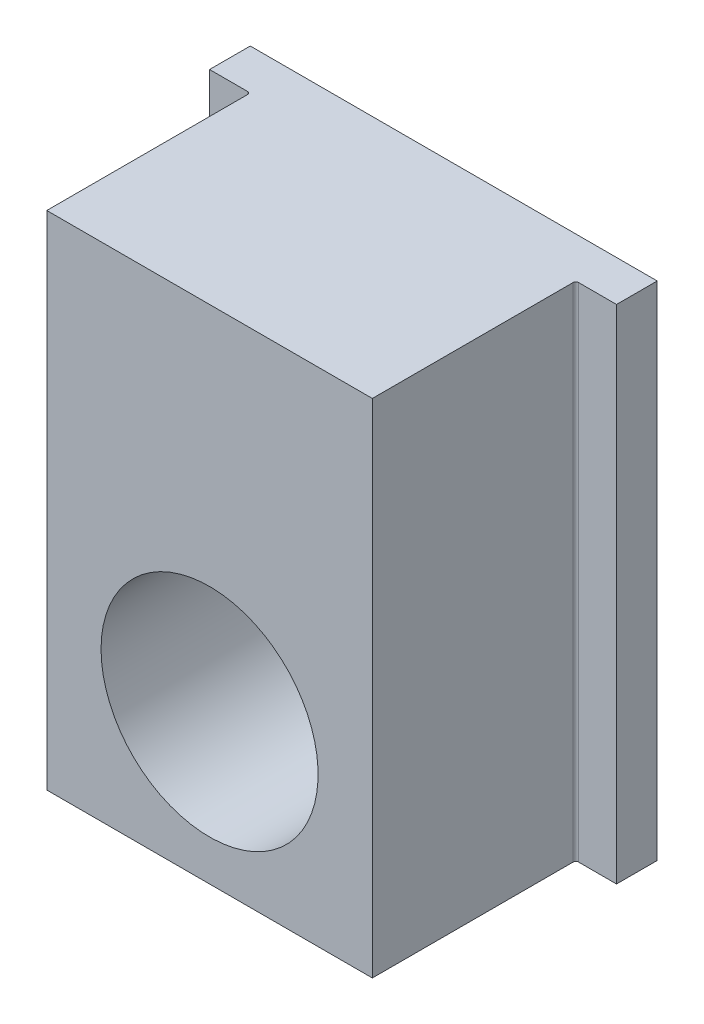
from build123d import *

# Parameters (mm, degrees)
ESTRUSIONE_ESTRUSIONE1_DEPTH = 37
SCHIZZO2_R                   = 8
TAGLIO_ESTRUSIONE1_DEPTH     = 44.794976881
RACCORDO3_R                  = 0.2
RACCORDO4_R                  = 0.2


with BuildPart() as part:
    # Schizzo1 → Estrusione-Estrusione1 (new body)
    with BuildSketch(Plane(origin=(0, 0, 0), x_dir=(1, 0, 0), z_dir=(0, 1, 0))):
        Polygon((-15, 13.566371681), (15, 13.566371681), (15, 10.566371681), (12, 10.566371681), (12, -4.433628319), (-12, -4.433628319), (-12, 10.566371681), (-15, 10.566371681), align=None)
    extrude(amount=ESTRUSIONE_ESTRUSIONE1_DEPTH)

    # Schizzo2 → Taglio-Estrusione1 (cut, through all)
    with BuildSketch(Plane(origin=(0, 0, -13.566371681), x_dir=(-1, 0, 0), z_dir=(0, 0, -1))):
        with Locations((0, 11)):
            Circle(SCHIZZO2_R)
    extrude(amount=-TAGLIO_ESTRUSIONE1_DEPTH, mode=Mode.SUBTRACT)

    # Raccordo3
    raccordo3_edges = [part.edges().sort_by_distance(p)[0] for p in [
        (-12, 18.5, -10.566371681),
    ]]
    fillet(raccordo3_edges, radius=RACCORDO3_R)

    # Raccordo4
    raccordo4_edges = [part.edges().sort_by_distance(p)[0] for p in [
        (12, 18.5, -10.566371681),
    ]]
    fillet(raccordo4_edges, radius=RACCORDO4_R)


solid = part.part
